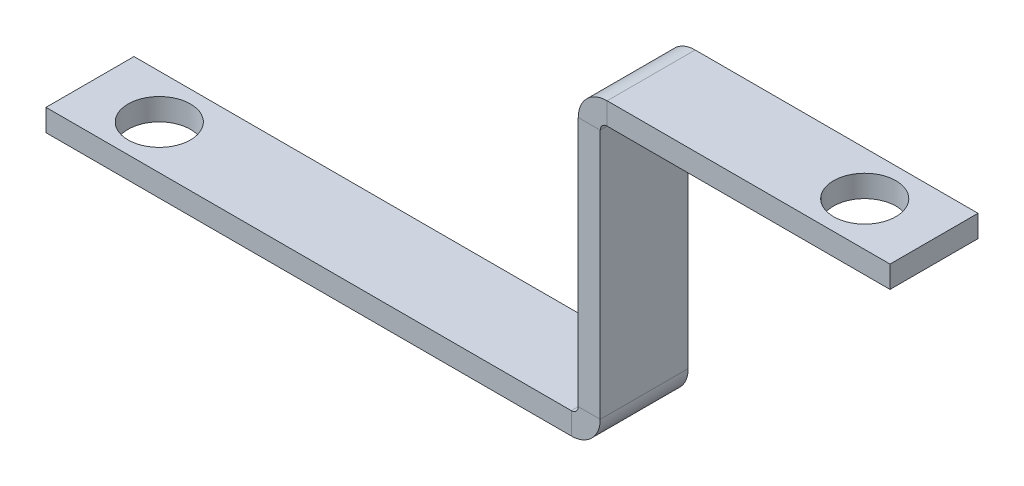
from build123d import *

# Parameters (mm, degrees)
SKETCH1_W                    = 80
SKETCH1_H                    = 12.7
BOSS_EXTRUDE1_DEPTH          = 3.175
EDGE_FLANGE1_STRIP_W         = 14.7
EDGE_FLANGE1_STRIP_H         = 3.175
EDGE_FLANGE1_STRIP_CUT_DEPTH = 12.7
EDGE_FLANGE1_DEPTH           = 12.7
EDGE_FLANGE2_STRIP_W         = 14.7
EDGE_FLANGE2_STRIP_H         = 3.175
EDGE_FLANGE2_STRIP_CUT_DEPTH = 12.7
EDGE_FLANGE2_DEPTH           = 12.7
M8_CLEARANCE_HOLE1_D         = 9


# Sheet-metal steps are written as plain solids
with BuildPart() as part:
    # Sketch1 → Boss-Extrude1 (new body)
    with BuildSketch(Plane(origin=(0, 0, 0), x_dir=(1, 0, 0), z_dir=(0, 1, 0))):
        with Locations((40, 6.35)):
            Rectangle(SKETCH1_W, SKETCH1_H)
    extrude(amount=BOSS_EXTRUDE1_DEPTH)

    # Edge-Flange1 strip (across the edge) → Edge-Flange1 strip cut (cut)
    with BuildSketch(Plane(origin=(80, 3.175, 0), x_dir=(-1, 0, 0), z_dir=(0, 0, -1))):
        with Locations((-3.175, -1.5875)):
            Rectangle(EDGE_FLANGE1_STRIP_W, EDGE_FLANGE1_STRIP_H)
    extrude(amount=EDGE_FLANGE1_STRIP_CUT_DEPTH, mode=Mode.SUBTRACT)

    # Edge-Flange1 section (across the edge) → Edge-Flange1 (add)
    with BuildSketch(Plane(origin=(80, 3.175, 0), x_dir=(-1, 0, 0), z_dir=(0, 0, -1))):
        with BuildLine():
            Line((0, 1), (0, 41.32))
            Line((0, 41.32), (3.175, 41.32))
            Line((3.175, 41.32), (3.175, 1))
            ThreePointArc((3.175, 1), (3.467893219, 0.292893219), (4.175, 0))
            Line((4.175, 0), (4.175, -3.175))
            ThreePointArc((4.175, -3.175), (1.222829189, -1.952170811), (0, 1))
        make_face()
    extrude(amount=EDGE_FLANGE1_DEPTH)

    # Edge-Flange2 strip (across the edge) → Edge-Flange2 strip cut (cut)
    with BuildSketch(Plane(origin=(80, 44.495, -12.7), x_dir=(0, -1, 0), z_dir=(0, 0, 1))):
        with Locations((-3.175, -1.5875)):
            Rectangle(EDGE_FLANGE2_STRIP_W, EDGE_FLANGE2_STRIP_H)
    extrude(amount=EDGE_FLANGE2_STRIP_CUT_DEPTH, mode=Mode.SUBTRACT)

    # Edge-Flange2 section (across the edge) → Edge-Flange2 (add)
    with BuildSketch(Plane(origin=(80, 44.495, -12.7), x_dir=(0, -1, 0), z_dir=(0, 0, 1))):
        with BuildLine():
            Line((0, 1), (0, 41.825))
            Line((0, 41.825), (3.175, 41.825))
            Line((3.175, 41.825), (3.175, 1))
            ThreePointArc((3.175, 1), (3.467893219, 0.292893219), (4.175, 0))
            Line((4.175, 0), (4.175, -3.175))
            ThreePointArc((4.175, -3.175), (1.222829189, -1.952170811), (0, 1))
        make_face()
    extrude(amount=EDGE_FLANGE2_DEPTH)

    # M8 Clearance Hole1 (through all)
    with Locations(Plane(origin=(0, 44.495, 0), x_dir=(1, 0, 0), z_dir=(0, 1, 0))):
        with Locations((111.825, 6.35), (10, 6.35)):
            Hole(M8_CLEARANCE_HOLE1_D / 2)


solid = part.part
